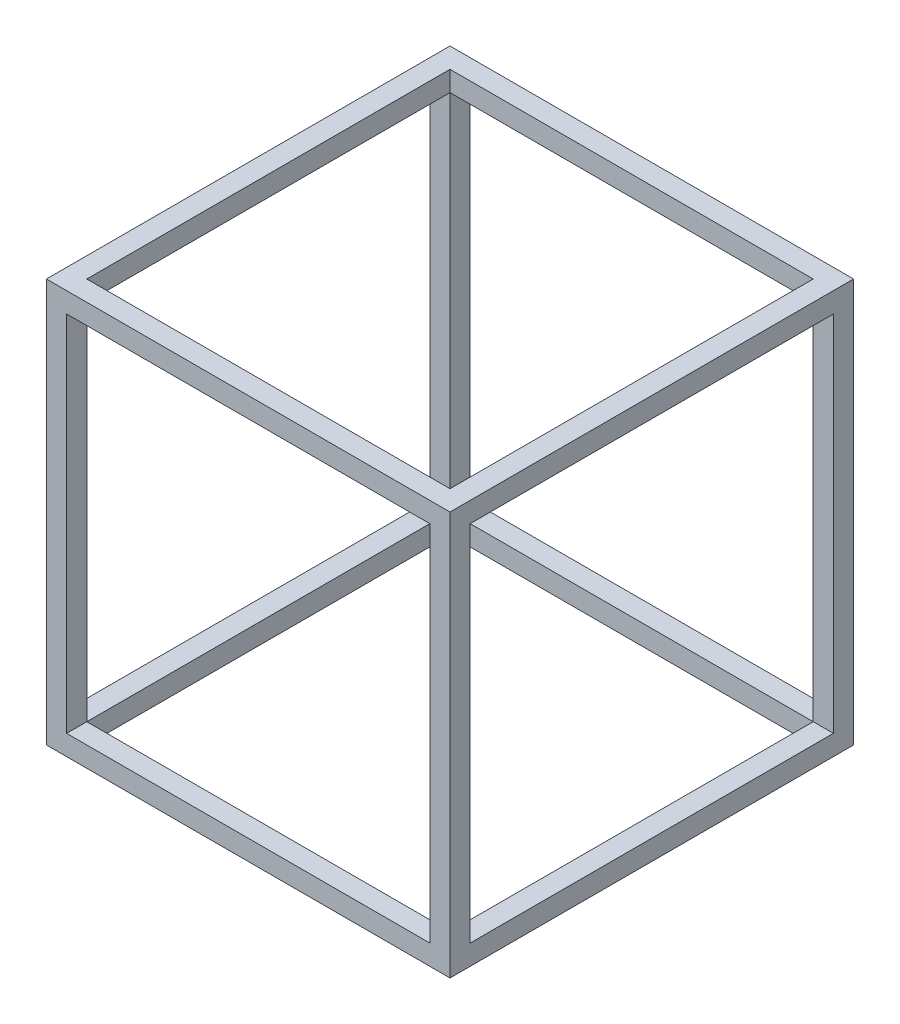
from build123d import *

# Parameters (mm, degrees)
SKETCH3_W             = 360
SKETCH3_H             = 20
BOSS_EXTRUDE4_DEPTH   = 20
SKETCH3_W_2           = 20
SKETCH3_H_2           = 360
BOSS_EXTRUDE4_2_DEPTH = 20
BOSS_EXTRUDE4_3_DEPTH = 20
BOSS_EXTRUDE4_4_DEPTH = 20
SKETCH3_5_W           = 20
SKETCH3_5_H           = 20
BOSS_EXTRUDE5_DEPTH   = 400
LPATTERN1_COUNT       = 2
LPATTERN1_PITCH       = 380


with BuildPart() as part:
    # Sketch3 → Boss-Extrude4 (new body)
    with BuildSketch(Plane(origin=(0, 0, 0), x_dir=(0, 1, 0), z_dir=(0, 0, 1))):
        with Locations((200, -10)):
            Rectangle(SKETCH3_W, SKETCH3_H)
    boss_extrude4 = extrude(amount=BOSS_EXTRUDE4_DEPTH)



with BuildPart() as body_2:
    # Sketch3 → Boss-Extrude4 2 (new body)
    with BuildSketch(Plane(origin=(0, 0, 0), x_dir=(0, 1, 0), z_dir=(0, 0, 1))):
        with Locations((10, -200)):
            Rectangle(SKETCH3_W_2, SKETCH3_H_2)
    boss_extrude4_2 = extrude(amount=BOSS_EXTRUDE4_2_DEPTH)


with BuildPart() as body_3:
    # Sketch3 → Boss-Extrude4 3 (new body)
    with BuildSketch(Plane(origin=(0, 0, 0), x_dir=(0, 1, 0), z_dir=(0, 0, 1))):
        with Locations((390, -200)):
            Rectangle(SKETCH3_W_2, SKETCH3_H_2)
    boss_extrude4_3 = extrude(amount=BOSS_EXTRUDE4_3_DEPTH)


with BuildPart() as body_4:
    # Sketch3 → Boss-Extrude4 4 (new body)
    with BuildSketch(Plane(origin=(0, 0, 0), x_dir=(0, 1, 0), z_dir=(0, 0, 1))):
        with Locations((200, -390)):
            Rectangle(SKETCH3_W, SKETCH3_H)
    boss_extrude4_4 = extrude(amount=BOSS_EXTRUDE4_4_DEPTH)


with BuildPart() as part_1:
    add(part.part)

    add(body_2.part)  # Boss-Extrude5 merges body 2

    add(body_3.part)  # Boss-Extrude5 merges body 3

    add(body_4.part)  # Boss-Extrude5 merges body 4
    # Sketch3<5> → Boss-Extrude5 (add)
    with BuildSketch(Plane(origin=(0, 0, 0), x_dir=(0, 1, 0), z_dir=(0, 0, 1))):
        with Locations((10, -10)):
            Rectangle(SKETCH3_5_W, SKETCH3_5_H)
        with Locations((390, -10)):
            Rectangle(SKETCH3_5_W, SKETCH3_5_H)
        with Locations((10, -390)):
            Rectangle(SKETCH3_5_W, SKETCH3_5_H)
        with Locations((390, -390)):
            Rectangle(SKETCH3_5_W, SKETCH3_5_H)
    extrude(amount=BOSS_EXTRUDE5_DEPTH)

    # LPattern1: Boss-Extrude4, Boss-Extrude4 2, Boss-Extrude4 3, Boss-Extrude4 4 ×2
    with Locations(*[(0, 0, i * LPATTERN1_PITCH) for i in range(1, LPATTERN1_COUNT)]):
        add(boss_extrude4)
        add(boss_extrude4_2)
        add(boss_extrude4_3)
        add(boss_extrude4_4)


solid = part_1.part
